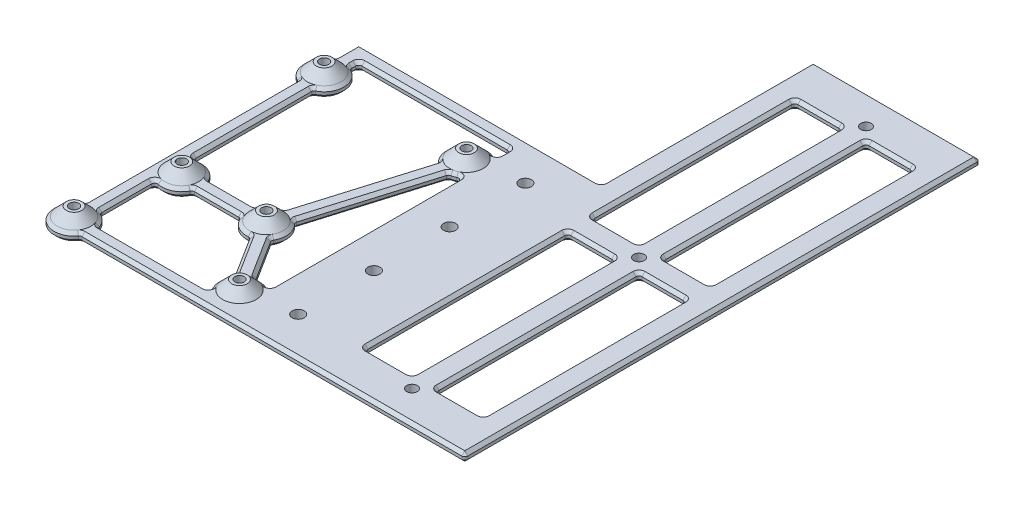
from build123d import *

# Parameters (mm, degrees)
SKETCH1_R           = 1.55
SKETCH1_R_2         = 1.75
SKETCH1_R_3         = 2
SKETCH1_W           = 15.5
SKETCH1_H           = 66.93
BOSS_EXTRUDE1_DEPTH = 3
FILLET1_R           = 1
CHAMFER1_SIZE       = 1
SKETCH3_R           = 5.55
SKETCH3_R_2         = 1.55
BOSS_EXTRUDE2_DEPTH = 3
CHAMFER2_SIZE       = 3


with BuildPart() as part:
    # Sketch1 → Boss-Extrude1 (new body)
    with BuildSketch(Plane(origin=(0, 0, 0), x_dir=(1, 0, 0), z_dir=(0, 1, 0))):
        with BuildLine():
            Line((-12.5, 0), (12.5, 0))
            Line((12.5, 0), (67.5, 0))
            Line((67.5, 0), (67.5, 170))
            Line((67.5, 170), (12.5, 170))
            Line((12.5, 170), (12.5, 100))
            Line((12.5, 100), (-12.5, 100))
            Line((-12.5, 100), (-67.5, 100))
            Line((-67.5, 100), (-67.5, 92.067458074))
            ThreePointArc((-67.5, 92.067458074), (-71.51, 86.03), (-67.5, 79.992541926))
            Line((-67.5, 79.992541926), (-67.5, 9.517458074))
            ThreePointArc((-67.5, 9.517458074), (-69.950903431, -0.761860787), (-59.410937016, 0))
            Line((-59.410937016, 0), (-12.5, 0))
        make_face()
        with Locations(Location((-64.96, 86.03, 0), (0, 0, 270))):
            Circle(SKETCH1_R, mode=Mode.SUBTRACT)
        with Locations(Location((-59.88, 33.96, 0), (0, 0, 270))):
            Circle(SKETCH1_R, mode=Mode.SUBTRACT)
        with Locations(Location((-64.96, 3.48, 0), (0, 0, 270))):
            Circle(SKETCH1_R, mode=Mode.SUBTRACT)
        with Locations(Location((-16.7, 84.76, 0), (0, 0, 270))):
            Circle(SKETCH1_R, mode=Mode.SUBTRACT)
        with Locations(Location((-16.7, 9.83, 0), (0, 0, 270))):
            Circle(SKETCH1_R, mode=Mode.SUBTRACT)
        with Locations(Location((-31.94, 33.96, 0), (0, 0, 270))):
            Circle(SKETCH1_R, mode=Mode.SUBTRACT)
        with Locations(Location((40, 159.93, 0), (0, 0, 270))):
            Circle(SKETCH1_R_2, mode=Mode.SUBTRACT)
        with Locations(Location((40, 85, 0), (0, 0, 270))):
            Circle(SKETCH1_R_2, mode=Mode.SUBTRACT)
        with Locations(Location((40, 10.07, 0), (0, 0, 270))):
            Circle(SKETCH1_R_2, mode=Mode.SUBTRACT)
        with Locations(Location((0, 87.5, 0), (0, 0, 270))):
            Circle(SKETCH1_R_3, mode=Mode.SUBTRACT)
        with Locations(Location((0, 62.5, 0), (0, 0, 270))):
            Circle(SKETCH1_R_3, mode=Mode.SUBTRACT)
        with Locations(Location((0, 37.5, 0), (0, 0, 270))):
            Circle(SKETCH1_R_3, mode=Mode.SUBTRACT)
        with Locations(Location((0, 12.5, 0), (0, 0, 270))):
            Circle(SKETCH1_R_3, mode=Mode.SUBTRACT)
        with BuildLine():
            Line((-58.588807019, 5), (-21.124206143, 5))
            ThreePointArc((-21.124206143, 5), (-23.212766498, 9.132595858), (-22.046585685, 13.613717948))
            Line((-22.046585685, 13.613717948), (-30.82085883, 27.506317095))
            ThreePointArc((-30.82085883, 27.506317095), (-35.101713593, 28.223618984), (-37.994130821, 31.46))
            Line((-37.994130821, 31.46), (-53.825869179, 31.46))
            ThreePointArc((-53.825869179, 31.46), (-57.427170833, 27.886604815), (-62.5, 27.95682584))
            Line((-62.5, 27.95682584), (-62.5, 9.550494214))
            ThreePointArc((-62.5, 9.550494214), (-59.992682639, 7.749456433), (-58.588807019, 5))
        make_face(mode=Mode.SUBTRACT)
        with BuildLine():
            Line((-62.5, 95), (-62.5, 92.100494214))
            ThreePointArc((-62.5, 92.100494214), (-58.41, 86.03), (-62.5, 79.959505786))
            Line((-62.5, 79.959505786), (-62.5, 39.96317416))
            ThreePointArc((-62.5, 39.96317416), (-57.427170833, 40.033395185), (-53.825869179, 36.46))
            Line((-53.825869179, 36.46), (-37.994130821, 36.46))
            ThreePointArc((-37.994130821, 36.46), (-35.849894969, 39.21501868), (-32.594924023, 40.477175349))
            Line((-32.594924023, 40.477175349), (-20.834207403, 79.679564079))
            ThreePointArc((-20.834207403, 79.679564079), (-21.753415761, 88.927191998), (-12.5, 89.786181453))
            Line((-12.5, 89.786181453), (-12.5, 95))
            Line((-12.5, 95), (-62.5, 95))
        make_face(mode=Mode.SUBTRACT)
        with BuildLine():
            Line((-26.593414315, 30.176282052), (-17.81914117, 16.283682905))
            ThreePointArc((-17.81914117, 16.283682905), (-15.002247697, 16.156147099), (-12.5, 14.856181453))
            Line((-12.5, 14.856181453), (-12.5, 79.733818547))
            ThreePointArc((-12.5, 79.733818547), (-14.160642303, 78.722271745), (-16.045075977, 78.242824651))
            Line((-16.045075977, 78.242824651), (-27.805792597, 39.040435921))
            ThreePointArc((-27.805792597, 39.040435921), (-25.450418708, 34.847600501), (-26.593414315, 30.176282052))
        make_face(mode=Mode.SUBTRACT)
        with Locations((51.75, 47.535)):
            Rectangle(SKETCH1_W, SKETCH1_H, mode=Mode.SUBTRACT)
        with Locations((28.25, 122.465)):
            Rectangle(SKETCH1_W, SKETCH1_H, mode=Mode.SUBTRACT)
        with Locations((28.25, 47.535)):
            Rectangle(SKETCH1_W, SKETCH1_H, mode=Mode.SUBTRACT)
        with Locations((51.75, 122.465)):
            Rectangle(SKETCH1_W, SKETCH1_H, mode=Mode.SUBTRACT)
    extrude(amount=BOSS_EXTRUDE1_DEPTH)

    # Fillet1
    fillet1_edges = [part.edges().sort_by_distance(p)[0] for p in [
        (-21.124206143, 1.5, -5),
        (-22.046585685, 1.5, -13.613717948),
        (-30.82085883, 1.5, -27.506317095),
        (-37.994130821, 1.5, -31.46),
        (-53.825869179, 1.5, -31.46),
        (-62.5, 1.5, -27.95682584),
        (-62.5, 1.5, -9.550494214),
        (-58.588807019, 1.5, -5),
        (20.5, 1.5, -155.93),
        (20.5, 1.5, -89),
        (36, 1.5, -89),
        (36, 1.5, -155.93),
        (36, 1.5, -14.07),
        (36, 1.5, -81),
        (20.5, 1.5, -81),
        (20.5, 1.5, -14.07),
        (59.5, 1.5, -14.07),
        (59.5, 1.5, -81),
        (44, 1.5, -81),
        (44, 1.5, -14.07),
        (-59.410937016, 1.5, 0),
        (59.5, 1.5, -155.93),
        (44, 1.5, -155.93),
        (-67.5, 1.5, -9.517458074),
        (44, 1.5, -89),
        (59.5, 1.5, -89),
        (-67.5, 1.5, -79.992541926),
        (-67.5, 1.5, -92.067458074),
        (-67.5, 1.5, -100),
        (12.5, 1.5, -100),
        (12.5, 1.5, -170),
        (67.5, 1.5, -170),
        (67.5, 1.5, 0),
        (-17.81914117, 1.5, -16.283682905),
        (-12.5, 1.5, -14.856181453),
        (-12.5, 1.5, -79.733818547),
        (-16.045075977, 1.5, -78.242824651),
        (-27.805792597, 1.5, -39.040435921),
        (-26.593414315, 1.5, -30.176282052),
        (-62.5, 1.5, -39.96317416),
        (-53.825869179, 1.5, -36.46),
        (-37.994130821, 1.5, -36.46),
        (-32.594924023, 1.5, -40.477175349),
        (-20.834207403, 1.5, -79.679564079),
        (-12.5, 1.5, -89.786181453),
        (-12.5, 1.5, -95),
        (-62.5, 1.5, -95),
        (-62.5, 1.5, -92.100494214),
        (-62.5, 1.5, -79.959505786),
    ]]
    fillet(fillet1_edges, radius=FILLET1_R)

    # Chamfer1
    chamfer1_edges = [part.edges().sort_by_distance(p)[0] for p in [
        (51.75, 0, -155.93),
        (51.75, 3, -155.93),
        (44, 0, -122.465),
        (44, 3, -122.465),
        (51.75, 0, -89),
        (51.75, 3, -89),
        (59.5, 0, -122.465),
        (59.5, 3, -122.465),
        (36, 0, -47.535),
        (36, 3, -47.535),
        (28.25, 0, -81),
        (28.25, 3, -81),
        (20.5, 0, -47.535),
        (20.5, 3, -47.535),
        (28.25, 0, -14.07),
        (28.25, 3, -14.07),
        (20.5, 0, -122.465),
        (20.5, 3, -122.465),
        (28.25, 0, -89),
        (28.25, 3, -89),
        (36, 0, -122.465),
        (36, 3, -122.465),
        (28.25, 0, -155.93),
        (28.25, 3, -155.93),
        (59.5, 0, -47.535),
        (59.5, 3, -47.535),
        (51.75, 0, -81),
        (51.75, 3, -81),
        (44, 0, -47.535),
        (44, 3, -47.535),
        (51.75, 0, -14.07),
        (51.75, 3, -14.07),
        (67.5, 0, -85),
        (67.5, 3, -85),
        (3.808589311, 0, 0),
        (-69.9196549, 0, 0.798355206),
        (-67.5, 0, -44.755),
        (-71.51, 0, -86.03),
        (-67.5, 0, -95.849325269),
        (-27.5, 0, -100),
        (12.5, 0, -135),
        (40, 0, -170),
        (-22.206277742, 0, -23.229982478),
        (-15.538981302, 0, -16.276280756),
        (-12.5, 0, -47.295),
        (-14.676145458, 0, -78.530512638),
        (-21.925434287, 0, -58.641630286),
        (-25.450418708, 0, -34.847600501),
        (-62.5, 0, -60.326822056),
        (-57.112284851, 0, -39.89651858),
        (-45.91, 0, -36.46),
        (-35.849894969, 0, -39.21501868),
        (-26.714565713, 0, -60.078369714),
        (-22.085216415, 0, -88.488531099),
        (-12.5, 0, -92.799155598),
        (-37.5, 0, -95),
        (-62.5, 0, -93.370253344),
        (-58.41, 0, -86.03),
        (-40.524699358, 0, -5),
        (-23.249964572, 0, -9.808456906),
        (-26.433722258, 0, -20.560017522),
        (-35.101713593, 0, -28.223618984),
        (-45.91, 0, -31.46),
        (-57.112284851, 0, -28.02348142),
        (-62.5, 0, -18.388177944),
        (-60.024986467, 0, -7.786755324),
        (-67.207106781, 0, -99.707106781),
        (12.792893219, 0, -169.707106781),
        (67.207106781, 0, -169.707106781),
        (67.207106781, 0, -0.292893219),
        (3.808589311, 3, 0),
        (-57.112284851, 3, -39.89651858),
        (-62.5, 3, -60.326822056),
        (-58.41, 3, -86.03),
        (-62.5, 3, -93.370253344),
        (-37.5, 3, -95),
        (-12.5, 3, -92.799155598),
        (-22.085216415, 3, -88.488531099),
        (-26.714565713, 3, -60.078369714),
        (-35.849894969, 3, -39.21501868),
        (-45.91, 3, -36.46),
        (40, 3, -170),
        (12.5, 3, -135),
        (-27.5, 3, -100),
        (-67.5, 3, -95.849325269),
        (-71.51, 3, -86.03),
        (-67.5, 3, -44.755),
        (-69.9196549, 3, 0.798355206),
        (-15.538981302, 3, -16.276280756),
        (-22.206277742, 3, -23.229982478),
        (-25.450418708, 3, -34.847600501),
        (-21.925434287, 3, -58.641630286),
        (-14.676145458, 3, -78.530512638),
        (-12.5, 3, -47.295),
        (-23.249964572, 3, -9.808456906),
        (-40.524699358, 3, -5),
        (-60.024986467, 3, -7.786755324),
        (-62.5, 3, -18.388177944),
        (-57.112284851, 3, -28.02348142),
        (-45.91, 3, -31.46),
        (-35.101713593, 3, -28.223618984),
        (-26.433722258, 3, -20.560017522),
        (-67.207106781, 3, -99.707106781),
        (12.792893219, 3, -169.707106781),
        (67.207106781, 3, -169.707106781),
        (67.207106781, 3, -0.292893219),
        (44.292893219, 0, -155.637106781),
        (44.292893219, 3, -155.637106781),
        (44.292893219, 0, -89.292893219),
        (44.292893219, 3, -89.292893219),
        (59.207106781, 0, -89.292893219),
        (59.207106781, 3, -89.292893219),
        (59.207106781, 0, -155.637106781),
        (59.207106781, 3, -155.637106781),
        (35.707106781, 0, -80.707106781),
        (35.707106781, 3, -80.707106781),
        (20.792893219, 0, -80.707106781),
        (20.792893219, 3, -80.707106781),
        (20.792893219, 0, -14.362893219),
        (20.792893219, 3, -14.362893219),
        (35.707106781, 0, -14.362893219),
        (35.707106781, 3, -14.362893219),
        (20.792893219, 0, -89.292893219),
        (20.792893219, 3, -89.292893219),
        (35.707106781, 0, -89.292893219),
        (35.707106781, 3, -89.292893219),
        (35.707106781, 0, -155.637106781),
        (35.707106781, 3, -155.637106781),
        (59.207106781, 0, -80.707106781),
        (59.207106781, 3, -80.707106781),
        (44.292893219, 0, -80.707106781),
        (44.292893219, 3, -80.707106781),
        (44.292893219, 0, -14.362893219),
        (44.292893219, 3, -14.362893219),
        (59.207106781, 0, -14.362893219),
        (59.207106781, 3, -14.362893219),
        (20.792893219, 0, -155.637106781),
        (20.792893219, 3, -155.637106781),
        (-67.643006951, 0, -92.183322571),
        (-67.643006951, 3, -92.183322571),
        (12.207106781, 0, -100.292893219),
        (12.207106781, 3, -100.292893219),
        (-67.643006951, 0, -79.876677429),
        (-67.643006951, 3, -79.876677429),
        (-67.643006951, 0, -9.633322571),
        (-67.643006951, 3, -9.633322571),
        (-59.333721875, 0, 0.107425778),
        (-59.333721875, 3, 0.107425778),
        (-22.231659792, 0, -13.636048265),
        (-22.231659792, 3, -13.636048265),
        (-30.880222111, 0, -27.32960527),
        (-30.880222111, 3, -27.32960527),
        (-38.111839132, 0, -31.315446129),
        (-38.111839132, 3, -31.315446129),
        (-53.708160868, 0, -31.315446129),
        (-53.708160868, 3, -31.315446129),
        (-62.126669954, 0, -27.365133981),
        (-62.126669954, 3, -27.365133981),
        (-62.353896406, 0, -9.670063677),
        (-62.353896406, 3, -9.670063677),
        (-58.420130187, 0, -5.183368249),
        (-58.420130187, 3, -5.183368249),
        (-22.338301803, 0, -5.503655749),
        (-22.338301803, 3, -5.503655749),
        (-12.963269649, 0, -15.824557363),
        (-12.963269649, 3, -15.824557363),
        (-12.963269649, 0, -78.765442637),
        (-12.963269649, 3, -78.765442637),
        (-27.633511865, 0, -39.111642786),
        (-27.633511865, 3, -39.111642786),
        (-26.408340208, 0, -30.153951735),
        (-26.408340208, 3, -30.153951735),
        (-17.759777889, 0, -16.46039473),
        (-17.759777889, 3, -16.46039473),
        (-53.708160868, 0, -36.604553871),
        (-53.708160868, 3, -36.604553871),
        (-38.111839132, 0, -36.604553871),
        (-38.111839132, 3, -36.604553871),
        (-32.699558286, 0, -40.631456712),
        (-32.699558286, 3, -40.631456712),
        (-21.006488135, 0, -79.608357214),
        (-21.006488135, 3, -79.608357214),
        (-12.963269649, 0, -90.754557363),
        (-12.963269649, 3, -90.754557363),
        (-12.792893219, 0, -94.707106781),
        (-12.792893219, 3, -94.707106781),
        (-62.207106781, 0, -94.707106781),
        (-62.207106781, 3, -94.707106781),
        (-62.353896406, 0, -92.220063677),
        (-62.353896406, 3, -92.220063677),
        (-62.353896406, 0, -79.839936323),
        (-62.353896406, 3, -79.839936323),
        (-62.126669954, 0, -40.554866019),
        (-62.126669954, 3, -40.554866019),
        (-15.940441714, 0, -78.088543288),
        (-15.940441714, 3, -78.088543288),
    ]]
    chamfer(chamfer1_edges, length=CHAMFER1_SIZE)

    # Sketch3 → Boss-Extrude2 (add)
    # profile 1 of 6: a face of its own
    with BuildSketch(Plane(origin=(0, 3, 0), x_dir=(1, 0, 0), z_dir=(0, 1, 0))):
        with Locations(Location((-64.96, 3.48, 0), (0, 0, 62.723944912))):
            Circle(SKETCH3_R)
        with Locations(Location((-64.96, 3.48, 0), (0, 0, 270))):
            Circle(SKETCH3_R_2, mode=Mode.SUBTRACT)
    # profile 2 of 6: a face of its own
    with BuildSketch(Plane(origin=(0, 3, 0), x_dir=(1, 0, 0), z_dir=(0, 1, 0))):
        with Locations(Location((-59.88, 33.96, 0), (0, 0, 102.390274186))):
            Circle(SKETCH3_R)
        with Locations(Location((-59.88, 33.96, 0), (0, 0, 270))):
            Circle(SKETCH3_R_2, mode=Mode.SUBTRACT)
    # profile 3 of 6: a face of its own
    with BuildSketch(Plane(origin=(0, 3, 0), x_dir=(1, 0, 0), z_dir=(0, 1, 0))):
        with Locations(Location((-31.94, 33.96, 0), (0, 0, 100.918868127))):
            Circle(SKETCH3_R)
        with Locations(Location((-31.94, 33.96, 0), (0, 0, 270))):
            Circle(SKETCH3_R_2, mode=Mode.SUBTRACT)
    # profile 4 of 6: a face of its own
    with BuildSketch(Plane(origin=(0, 3, 0), x_dir=(1, 0, 0), z_dir=(0, 1, 0))):
        with Locations(Location((-16.7, 9.83, 0), (0, 0, 94.657531953))):
            Circle(SKETCH3_R)
        with Locations(Location((-16.7, 9.83, 0), (0, 0, 270))):
            Circle(SKETCH3_R_2, mode=Mode.SUBTRACT)
    # profile 5 of 6: a face of its own
    with BuildSketch(Plane(origin=(0, 3, 0), x_dir=(1, 0, 0), z_dir=(0, 1, 0))):
        with Locations(Location((-16.7, 84.76, 0), (0, 0, 64.92267171))):
            Circle(SKETCH3_R)
        with Locations(Location((-16.7, 84.76, 0), (0, 0, 270))):
            Circle(SKETCH3_R_2, mode=Mode.SUBTRACT)
    # profile 6 of 6: a face of its own
    with BuildSketch(Plane(origin=(0, 3, 0), x_dir=(1, 0, 0), z_dir=(0, 1, 0))):
        with Locations(Location((-64.96, 86.03, 0), (0, 0, 62.723944912))):
            Circle(SKETCH3_R)
        with Locations(Location((-64.96, 86.03, 0), (0, 0, 270))):
            Circle(SKETCH3_R_2, mode=Mode.SUBTRACT)
    extrude(amount=BOSS_EXTRUDE2_DEPTH)

    # Chamfer2
    chamfer2_edges = [part.edges().sort_by_distance(p)[0] for p in [
        (-67.503443709, 6, 1.452889022),
        (-58.689139073, 6, -28.539266632),
        (-30.888725646, 6, -28.510475045),
        (-16.249341269, 6, -4.298326952),
        (-19.052317881, 6, -79.733161969),
        (-67.503443709, 6, -81.097110978),
    ]]
    chamfer(chamfer2_edges, length=CHAMFER2_SIZE - 0.0001)  # a hair under: the kernel refuses the full size


solid = part.part
